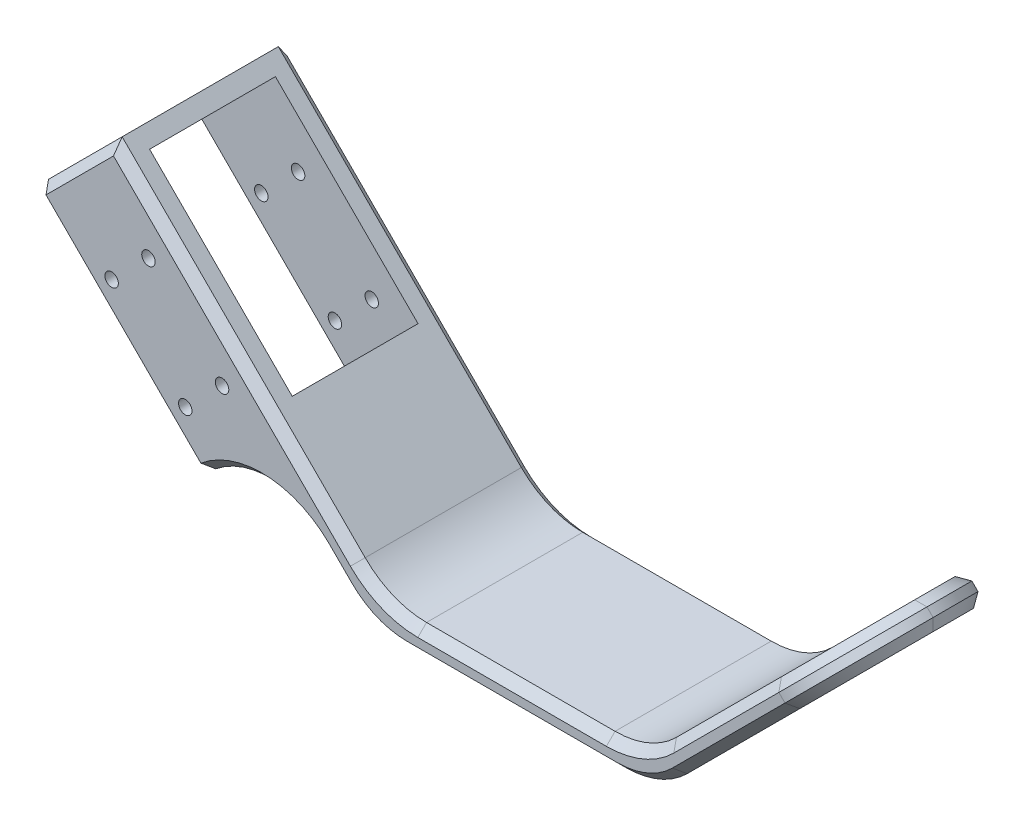
from build123d import *

# Parameters (mm, degrees)
BOSS_EXTRUDE1_DEPTH     = 40
SKETCH2_R               = 1.5
CUT_EXTRUDE1_DEPTH      = 40
SKETCH3_W               = 40
SKETCH3_H               = 54.5
SKETCH3_W_2             = 29
SKETCH3_H_2             = 46.5
BOSS_EXTRUDE2_DEPTH     = 18
SKETCH4_W               = 29
SKETCH4_H               = 46.5
CUT_EXTRUDE2_DEPTH      = 40
CUT_EXTRUDE3_DEPTH      = 137.090235877
CUT_EXTRUDE3_DEPTH_BACK = 137.090235877
SKETCH5_R               = 1.55
SKETCH5_R_2             = 1.05
FILLET1_R               = 20
FILLET2_R               = 20
FILLET3_R               = 20
CHAMFER1_SIZE           = 2


# Some blends are built 0.0001 mm under size
with BuildPart() as part:
    # Sketch1 → Boss-Extrude1 (new body)
    with BuildSketch(Plane.XY):
        Polygon((-63.639610307, 63.639610307), (0, 0), (0, 6), (2.485281374, 6), (-59.39696962, 67.882250994), align=None)
        Polygon((0, 6), (0, 0), (4.242640687, 4.242640687), (2.485281374, 6), align=None)
        Polygon((4.242640687, 4.242640687), (0, 0), (65, 0), (60.757359313, 4.242640687), (62.514718626, 6), (2.485281374, 6), align=None)
        Polygon((60.757359313, 4.242640687), (65, 0), (65, 6), (62.514718626, 6), align=None)
        Polygon((65, 6), (65, 0), (110.961940777, 45.961940777), (106.71930009, 50.204581464), (62.514718626, 6), align=None)
    extrude(amount=BOSS_EXTRUDE1_DEPTH)

    # Sketch2 → Cut-Extrude1 (cut)
    with BuildSketch(Plane(origin=(28.257359313, -28.257359313, 0), x_dir=(0, 0, 1), z_dir=(-0.7071067811865464, 0.7071067811865488, 0))):
        with Locations(Location((20, 82.961940777, 0), (0, 0, 270))):
            Circle(SKETCH2_R)
        with Locations(Location((12, 90.961940777, 0), (0, 0, 270))):
            Circle(SKETCH2_R)
        with BuildLine():
            ThreePointArc((24, 90.961940777), (21.530733729, 94.657458907), (17.171572875, 93.790367902))
            Line((17.171572875, 93.790367902), (22.828427125, 88.133513652))
            ThreePointArc((22.828427125, 88.133513652), (23.69551813, 89.431207048), (24, 90.961940777))
        make_face()
        with BuildLine():
            Line((22.828427125, 88.133513652), (17.171572875, 93.790367902))
            ThreePointArc((17.171572875, 93.790367902), (17.171572875, 88.133513652), (22.828427125, 88.133513652))
        make_face()
        with Locations(Location((20, 98.961940777, 0), (0, 0, 270))):
            Circle(SKETCH2_R)
        with Locations(Location((28, 90.961940777, 0), (0, 0, 270))):
            Circle(SKETCH2_R)
    extrude(amount=-CUT_EXTRUDE1_DEPTH, mode=Mode.SUBTRACT)

    # Sketch3 → Boss-Extrude2 (add)
    with BuildSketch(Plane(origin=(0, 0, 0), x_dir=(0, 0, 1), z_dir=(-0.7071067811865464, -0.7071067811865488, 0))):
        with Locations((20, 62.75)):
            Rectangle(SKETCH3_W, SKETCH3_H)
        with Locations((20, 62.75)):
            Rectangle(SKETCH3_W_2, SKETCH3_H_2, mode=Mode.SUBTRACT)
    extrude(amount=BOSS_EXTRUDE2_DEPTH)

    # Sketch4 → Cut-Extrude2 (cut)
    with BuildSketch(Plane(origin=(0, 0, 0), x_dir=(0, 0, 1), z_dir=(-0.7071067811865464, -0.7071067811865488, 0))):
        with Locations((20, 62.75)):
            Rectangle(SKETCH4_W, SKETCH4_H)
    extrude(amount=-CUT_EXTRUDE2_DEPTH, mode=Mode.SUBTRACT)

    # Sketch5 → Cut-Extrude3 (cut, two sides: drawn at the far end of the back side and taken through both)
    # profile 1 of 8: a face of its own
    with BuildSketch(Plane.XY.offset(40).offset(-CUT_EXTRUDE3_DEPTH_BACK)):
        with Locations((-51.335952314, 48.648946546)):
            Circle(SKETCH5_R)
        with Locations((-51.335952314, 48.648946546)):
            Circle(SKETCH5_R_2, mode=Mode.SUBTRACT)
    # profile 2 of 8: a face of its own
    with BuildSketch(Plane.XY.offset(40).offset(-CUT_EXTRUDE3_DEPTH_BACK)):
        with Locations((-51.335952314, 48.648946546)):
            Circle(SKETCH5_R_2)
    # profile 3 of 8: a face of its own
    with BuildSketch(Plane.XY.offset(40).offset(-CUT_EXTRUDE3_DEPTH_BACK)):
        with Locations((-59.821233688, 40.163665171)):
            Circle(SKETCH5_R)
        with Locations((-59.821233688, 40.163665171)):
            Circle(SKETCH5_R_2, mode=Mode.SUBTRACT)
    # profile 4 of 8: a face of its own
    with BuildSketch(Plane.XY.offset(40).offset(-CUT_EXTRUDE3_DEPTH_BACK)):
        with Locations((-59.821233688, 40.163665171)):
            Circle(SKETCH5_R_2)
    # profile 5 of 8: a face of its own
    with BuildSketch(Plane.XY.offset(40).offset(-CUT_EXTRUDE3_DEPTH_BACK)):
        with Locations((-34.365389566, 31.678383797)):
            Circle(SKETCH5_R)
        with Locations((-34.365389566, 31.678383797)):
            Circle(SKETCH5_R_2, mode=Mode.SUBTRACT)
    # profile 6 of 8: a face of its own
    with BuildSketch(Plane.XY.offset(40).offset(-CUT_EXTRUDE3_DEPTH_BACK)):
        with Locations((-34.365389566, 31.678383797)):
            Circle(SKETCH5_R_2)
    # profile 7 of 8: a face of its own
    with BuildSketch(Plane.XY.offset(40).offset(-CUT_EXTRUDE3_DEPTH_BACK)):
        with Locations((-42.85067094, 23.193102423)):
            Circle(SKETCH5_R)
        with Locations((-42.85067094, 23.193102423)):
            Circle(SKETCH5_R_2, mode=Mode.SUBTRACT)
    # profile 8 of 8: a face of its own
    with BuildSketch(Plane.XY.offset(40).offset(-CUT_EXTRUDE3_DEPTH_BACK)):
        with Locations((-42.85067094, 23.193102423)):
            Circle(SKETCH5_R_2)
    extrude(amount=CUT_EXTRUDE3_DEPTH + CUT_EXTRUDE3_DEPTH_BACK, mode=Mode.SUBTRACT)

    # Fillet1
    fillet1_edges = [part.edges().sort_by_distance(p)[0] for p in [
        (0, 0, 20),
        (2.485281374, 6, 20),
        (62.514718626, 6, 20),
        (65, 0, 20),
    ]]
    fillet(fillet1_edges, radius=FILLET1_R)

    # Fillet2
    # the kernel refuses this fillet: 20 mm, written as the material it adds along each edge
    with BuildSketch(Plane(origin=(-25.102290732, 25.102290732, 0), x_dir=(0.7071067811865487, -0.7071067811865465, 0), z_dir=(0, 0, 1))) as fillet2_piece_1:
        with BuildLine():
            CenterArc((19.899748742, -20), FILLET2_R, 90, 84.260829523)
            Line((0, -18), (-0.397994975, -17.96))
            ThreePointArc((-0.397994975, -17.96), (-0.4, -9), (-0.4, 0))
            Line((-0.4, 0), (0, 0.4))
            Line((0, 0.4), (19.899748742, 0.4))
            Line((19.899748742, 0.4), (19.899748742, 0))
        make_face()
    extrude(amount=40)

    # Fillet3
    fillet3_edges = [part.edges().sort_by_distance(p)[0] for p in [
        (108.840620434, 48.083261121, 0),
        (108.840620434, 48.083261121, 40),
    ]]
    fillet(fillet3_edges, radius=FILLET3_R - 0.0001)  # a hair under: the kernel refuses the full size

    # Chamfer1
    chamfer1_edges = [part.edges().sort_by_distance(p)[0] for p in [
        (-67.882250994, 59.39696962, 0),
        (32.5, 0, 0),
        (32.5, 0, 40),
        (-8.444453914, 8.444453914, 0),
        (-31.384776311, 39.870057685, 0),
        (32.5, 6, 0),
        (80.474909089, 23.960190464, 0),
        (83.83887012, 18.83887012, 0),
        (64.3693974, 1.52240935, 0),
        (0.6306026, 1.52240935, 0),
        (-8.444453914, 8.444453914, 40),
        (83.83887012, 18.83887012, 40),
        (80.474909089, 23.960190464, 40),
        (32.5, 6, 40),
        (-31.384776311, 39.870057685, 40),
        (64.3693974, 1.52240935, 40),
        (0.6306026, 1.52240935, 40),
        (3.115883974, 7.52240935, 0),
        (3.115883974, 7.52240935, 40),
        (61.884116026, 7.52240935, 0),
        (61.884116026, 7.52240935, 40),
        (-24.171923575, 16.863829291, 40),
        (-24.171923575, 16.863829291, 0),
        (106.819825864, 41.819825864, 34.142164913),
        (106.819825864, 41.819825864, 5.857835087),
        (102.577185177, 46.062466551, 34.142164913),
        (102.577185177, 46.062466551, 5.857835087),
        (-67.882250994, 59.39696962, 40),
    ]]
    chamfer(chamfer1_edges, length=CHAMFER1_SIZE)


solid = part.part
